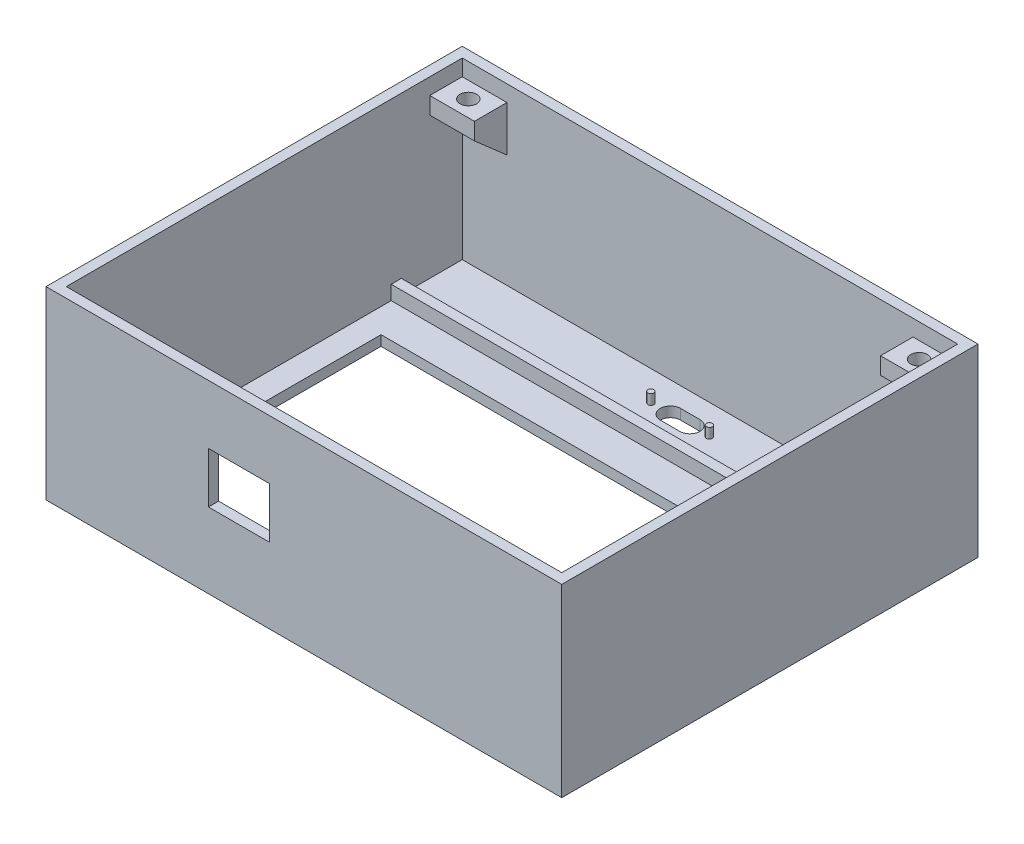
from build123d import *

# Parameters (mm, degrees)
SKETCH1_W            = 127
SKETCH1_H            = 85
BOSS_EXTRUDE1_DEPTH  = 2.5
SKETCH2_W            = 127
SKETCH2_H            = 85
SKETCH2_W_2          = 122
SKETCH2_H_2          = 80
BOSS_EXTRUDE2_DEPTH  = 38.5
SKETCH3_W            = 110
SKETCH3_H            = 68.5
CUT_EXTRUDE1_DEPTH   = 2.5
BOSS_EXTRUDE3_DEPTH  = 15
SKETCH10_W           = 122
SKETCH10_H           = 2.5
CUT_EXTRUDE2_DEPTH   = 35
SKETCH11_W           = 127
SKETCH11_H           = 41
BOSS_EXTRUDE4_DEPTH  = 2.5
CUT_EXTRUDE4_DEPTH   = 2.5
SKETCH14_W           = 15
SKETCH14_H           = 2.481033312
CUT_EXTRUDE5_DEPTH   = 1.5
SKETCH13_R           = 0.725
BOSS_EXTRUDE6_DEPTH  = 2.5
SKETCH17_W           = 15
SKETCH17_H           = 12.5
CUT_EXTRUDE6_DEPTH   = 2.5
SKETCH19_W           = 127
SKETCH19_H           = 102.5
SKETCH19_W_2         = 122
SKETCH19_H_2         = 97.5
BOSS_EXTRUDE7_DEPTH  = 4.5
SKETCH20_W           = 11
SKETCH20_H           = 4.184181858
BOSS_EXTRUDE8_DEPTH  = 8
SKETCH22_R           = 2.05
CUT_EXTRUDE7_DEPTH   = 5
BOSS_EXTRUDE9_DEPTH  = 11
BOSS_EXTRUDE10_DEPTH = 11


with BuildPart() as part:
    # Sketch1 → Boss-Extrude1 (new body)
    with BuildSketch(Plane(origin=(0, 0, 0), x_dir=(1, 0, 0), z_dir=(0, 1, 0))):
        with Locations((63.5, 42.5)):
            Rectangle(SKETCH1_W, SKETCH1_H)
    extrude(amount=BOSS_EXTRUDE1_DEPTH)

    # Sketch2 → Boss-Extrude2 (add)
    with BuildSketch(Plane(origin=(0, 2.5, 0), x_dir=(1, 0, 0), z_dir=(0, 1, 0))):
        with Locations((63.5, 42.5)):
            Rectangle(SKETCH2_W, SKETCH2_H)
        with Locations((63.5, 42.5)):
            Rectangle(SKETCH2_W_2, SKETCH2_H_2, mode=Mode.SUBTRACT)
    extrude(amount=BOSS_EXTRUDE2_DEPTH)

    # Sketch3 → Cut-Extrude1 (cut)
    with BuildSketch(Plane(origin=(0, 0, 0), x_dir=(-1, 0, 0), z_dir=(0, -1, 0))):
        with Locations((-63.5, 39.75)):
            Rectangle(SKETCH3_W, SKETCH3_H)
    extrude(amount=-CUT_EXTRUDE1_DEPTH, mode=Mode.SUBTRACT)

    # Sketch9 → Boss-Extrude3 (add)
    with BuildSketch(Plane(origin=(0, 0, -85), x_dir=(-1, 0, 0), z_dir=(0, 0, -1))):
        Polygon((-127, 0), (0, 0), (0, 2.5), (0, 41), (-2.5, 41), (-2.5, 2.5), (-124.5, 2.5), (-124.5, 41), (-127, 41), (-127, 2.5), align=None)
    extrude(amount=BOSS_EXTRUDE3_DEPTH)

    # Sketch10 → Cut-Extrude2 (cut)
    with BuildSketch(Plane(origin=(0, 41, 0), x_dir=(1, 0, 0), z_dir=(0, 1, 0))):
        with Locations((63.5, 83.75)):
            Rectangle(SKETCH10_W, SKETCH10_H)
    extrude(amount=-CUT_EXTRUDE2_DEPTH, mode=Mode.SUBTRACT)

    # Sketch11 → Boss-Extrude4 (add)
    with BuildSketch(Plane(origin=(0, 0, -100), x_dir=(-1, 0, 0), z_dir=(0, 0, -1))):
        with Locations((-63.5, 20.5)):
            Rectangle(SKETCH11_W, SKETCH11_H)
    extrude(amount=BOSS_EXTRUDE4_DEPTH)

    # Sketch6 → Cut-Extrude4 (cut)
    with BuildSketch(Plane(origin=(0, 0, 0), x_dir=(-1, 0, 0), z_dir=(0, -1, 0))):
        with BuildLine():
            Line((-61.1, 90.153713072), (-65.9, 90.153713072))
            ThreePointArc((-65.9, 90.153713072), (-68.4, 92.653713072), (-65.9, 95.153713072))
            Line((-65.9, 95.153713072), (-61.1, 95.153713072))
            ThreePointArc((-61.1, 95.153713072), (-58.6, 92.653713072), (-61.1, 90.153713072))
        make_face()
    extrude(amount=-CUT_EXTRUDE4_DEPTH, mode=Mode.SUBTRACT)

    # Sketch14 → Cut-Extrude5 (cut)
    with BuildSketch(Plane(origin=(0, 2.5, 0), x_dir=(1, 0, 0), z_dir=(0, 1, 0))):
        with Locations((63.5, 86.312856012)):
            Rectangle(SKETCH14_W, SKETCH14_H)
    extrude(amount=-CUT_EXTRUDE5_DEPTH, mode=Mode.SUBTRACT)

    # Sketch13 → Boss-Extrude6 (add)
    with BuildSketch(Plane(origin=(0, 2.5, 0), x_dir=(1, 0, 0), z_dir=(0, 1, 0))):
        with Locations((56.3, 92.653713072)):
            Circle(SKETCH13_R)
        with Locations((70.7, 92.653713072)):
            Circle(SKETCH13_R)
    extrude(amount=BOSS_EXTRUDE6_DEPTH)

    # Sketch17 → Cut-Extrude6 (cut)
    with BuildSketch(Plane.XY):
        with Locations((47.5, 24.75)):
            Rectangle(SKETCH17_W, SKETCH17_H)
    extrude(amount=-CUT_EXTRUDE6_DEPTH, mode=Mode.SUBTRACT)

    # Sketch19 → Boss-Extrude7 (add)
    with BuildSketch(Plane(origin=(0, 41, 0), x_dir=(1, 0, 0), z_dir=(0, 1, 0))):
        with Locations((63.5, 51.25)):
            Rectangle(SKETCH19_W, SKETCH19_H)
        with Locations((63.5, 51.25)):
            Rectangle(SKETCH19_W_2, SKETCH19_H_2, mode=Mode.SUBTRACT)
    extrude(amount=BOSS_EXTRUDE7_DEPTH)

    # Sketch20 → Boss-Extrude8 (add)
    with BuildSketch(Plane.XY.offset(-100)):
        with Locations((8, 39.407909071)):
            Rectangle(SKETCH20_W, SKETCH20_H)
        with Locations((119, 39.407909071)):
            Rectangle(SKETCH20_W, SKETCH20_H)
    extrude(amount=BOSS_EXTRUDE8_DEPTH)

    # Sketch22 → Cut-Extrude7 (cut)
    with BuildSketch(Plane(origin=(0, 41.5, 0), x_dir=(1, 0, 0), z_dir=(0, 1, 0))):
        with Locations((8, 96)):
            Circle(SKETCH22_R)
        with Locations((119, 96)):
            Circle(SKETCH22_R)
    extrude(amount=-CUT_EXTRUDE7_DEPTH, mode=Mode.SUBTRACT)

    # Sketch23 → Boss-Extrude9 (add)
    with BuildSketch(Plane(origin=(2.5, 0, 0), x_dir=(0, 0, -1), z_dir=(1, 0, 0))):
        Polygon((92, 37.315818142), (100, 37.315818142), (100, 30.315818142), align=None)
    extrude(amount=BOSS_EXTRUDE9_DEPTH)

    # Sketch24 → Boss-Extrude10 (add)
    with BuildSketch(Plane.ZY.offset(-124.5)):
        Polygon((-92, 37.315818142), (-100, 37.315818142), (-100, 30.315818142), align=None)
    extrude(amount=BOSS_EXTRUDE10_DEPTH)


solid = part.part
